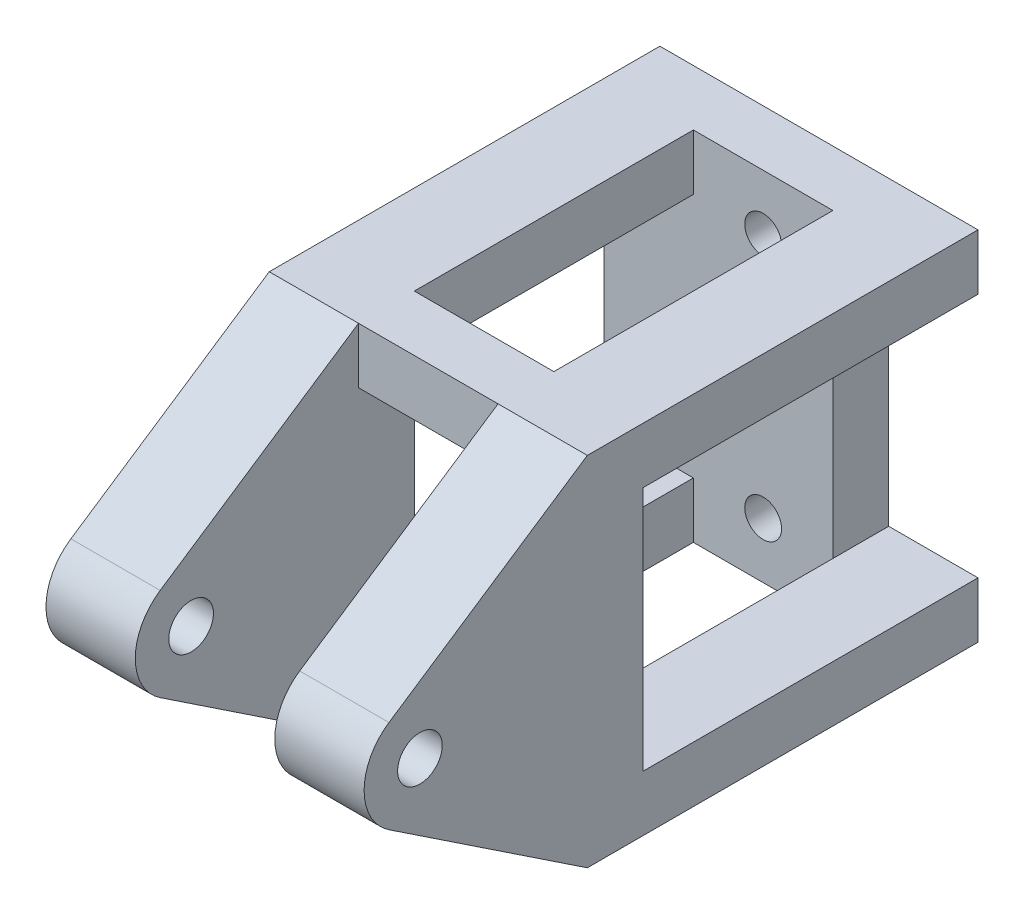
from build123d import *

# Parameters (mm, degrees)
SKETCH_1_W          = 28.5
SKETCH_1_H          = 32
EXTRUDE_1_DEPTH     = 5
SKETCH_3_R          = 2
EXTRUDE_2_DEPTH     = 8
SKETCH_4_R          = 1.65
CUT_EXTRUDE_1_DEPTH = 55.397265556
SKETCH_5_R          = 1.65
CUT_EXTRUDE_2_DEPTH = 5
SKETCH_6_W          = 25
SKETCH_6_H          = 22
CUT_EXTRUDE_3_DEPTH = 64.978512018
EXTRUDE_3_REACH     = 62.838
SKETCH_7_W          = 5
SKETCH_7_H          = 5
SKETCH_8_W          = 8
SKETCH_8_H          = 22
CUT_EXTRUDE_4_DEPTH = 10


with BuildPart() as part:
    # ｽｹｯﾁ1 → ﾎﾞｽ - 押し出し1 (new body)
    with BuildSketch(Plane.XY):
        Rectangle(SKETCH_1_W, SKETCH_1_H)
    extrude(amount=EXTRUDE_1_DEPTH)

    # ｽｹｯﾁ3 → ﾎﾞｽ - 押し出し2 (add)
    with BuildSketch(Plane(origin=(14.25, 0, 0), x_dir=(0, 0, -1), z_dir=(1, 0, 0))):
        with BuildLine():
            Line((-5, 16), (-35, 16))
            Line((-35, 16), (-52.772001082, 4.161251014))
            ThreePointArc((-52.772001082, 4.161251014), (-55, 0), (-52.772001082, -4.161251014))
            Line((-52.772001082, -4.161251014), (-35, -16))
            Line((-35, -16), (-5, -16))
            Line((-5, -16), (-5, 16))
        make_face()
        with Locations((-50, 0)):
            Circle(SKETCH_3_R, mode=Mode.SUBTRACT)
    extrude_2 = extrude(amount=-EXTRUDE_2_DEPTH)

    # ﾐﾗｰ1: ﾎﾞｽ - 押し出し2 across plane
    add(extrude_2.mirror(Plane(origin=(0, 0, 0), x_dir=(0, 0, 1), z_dir=(1, 0, 0))))

    # ｽｹｯﾁ4 → ｶｯﾄ - 押し出し1 (cut, through all)
    with BuildSketch(Plane.XY.offset(5)):
        with Locations((0, 11)):
            Circle(SKETCH_4_R)
        with Locations((0, -11)):
            Circle(SKETCH_4_R)
    extrude(amount=-CUT_EXTRUDE_1_DEPTH, mode=Mode.SUBTRACT)

    # ｽｹｯﾁ5 → ｶｯﾄ - 押し出し2 (cut)
    with BuildSketch(Plane.XY):
        with Locations((12.35, -5)):
            Circle(SKETCH_5_R)
        with Locations((12.35, 5)):
            Circle(SKETCH_5_R)
    extrude(amount=CUT_EXTRUDE_2_DEPTH, mode=Mode.SUBTRACT)

    # ｽｹｯﾁ6 → ｶｯﾄ - 押し出し3 (cut, through all)
    with BuildSketch(Plane(origin=(14.25, 0, 0), x_dir=(0, 0, -1), z_dir=(1, 0, 0))):
        with Locations((-17.5, 0)):
            Rectangle(SKETCH_6_W, SKETCH_6_H)
    extrude(amount=-CUT_EXTRUDE_3_DEPTH, mode=Mode.SUBTRACT)

    # ｽｹｯﾁ7 → ﾎﾞｽ - 押し出し3 (add, up to next)
    with BuildSketch(Plane(origin=(-6.25, 0, 0), x_dir=(0, 0, -1), z_dir=(1, 0, 0)), mode=Mode.PRIVATE) as extrude_3_sk1:
        with Locations((-32.5, 13.5)):
            Rectangle(SKETCH_7_W, SKETCH_7_H)
    extrude_3_tool1 = extrude(extrude_3_sk1.sketch, amount=EXTRUDE_3_REACH, mode=Mode.PRIVATE) - part.part
    # ｽｹｯﾁ7 → ﾎﾞｽ - 押し出し3 (add, up to next)
    with BuildSketch(Plane(origin=(-6.25, 0, 0), x_dir=(0, 0, -1), z_dir=(1, 0, 0)), mode=Mode.PRIVATE) as extrude_3_sk2:
        with Locations((-32.5, -13.5)):
            Rectangle(SKETCH_7_W, SKETCH_7_H)
    extrude_3_tool2 = extrude(extrude_3_sk2.sketch, amount=EXTRUDE_3_REACH, mode=Mode.PRIVATE) - part.part
    add(extrude_3_tool1.solids().sort_by_distance((-6.25, 13.5, 32.5))[0])
    add(extrude_3_tool2.solids().sort_by_distance((-6.25, -13.5, 32.5))[0])

    # ｽｹｯﾁ8 → ｶｯﾄ - 押し出し4 (cut)
    with BuildSketch(Plane(origin=(0, 0, 0), x_dir=(-1, 0, 0), z_dir=(0, 0, -1))):
        with Locations((-10.25, 0)):
            Rectangle(SKETCH_8_W, SKETCH_8_H)
    extrude(amount=-CUT_EXTRUDE_4_DEPTH, mode=Mode.SUBTRACT)


solid = part.part
